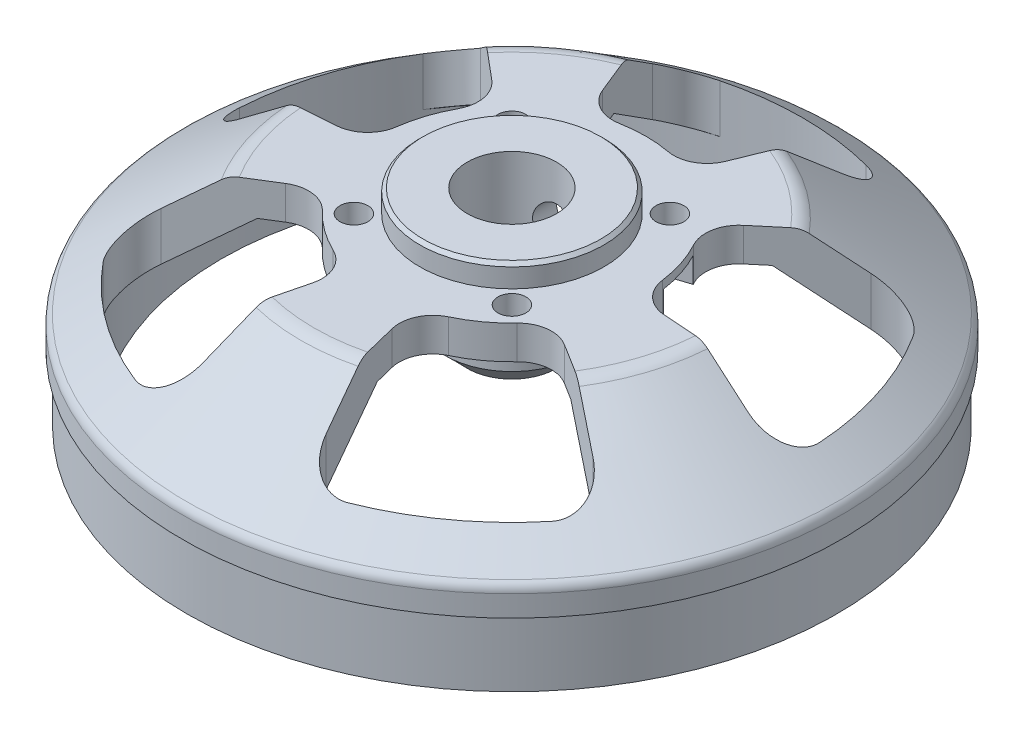
from build123d import *

# Parameters (mm, degrees)
SKETCH1_R           = 29.075
SKETCH1_R_2         = 26
BOSS_EXTRUDE1_DEPTH = 6
CUT_EXTRUDE1_DEPTH  = 45.863682
CIRPATTERN1_COUNT   = 5
SKETCH7_R           = 1.25
CUT_EXTRUDE2_DEPTH  = 45.863682
SKETCH8_R           = 6
BOSS_EXTRUDE3_DEPTH = 7
CHAMFER2_SIZE       = 2
SKETCH9_R           = 4
CUT_EXTRUDE3_DEPTH  = 44.410828
CUT_EXTRUDE4_START  = -2.25
CUT_EXTRUDE4_DEPTH  = 2.25
SKETCH11_R          = 1.75
CUT_EXTRUDE5_DEPTH  = 11
CIRPATTERN2_COUNT   = 2
CIRPATTERN2_ANGLE   = 72


with BuildPart() as part:
    # Sketch1 → Boss-Extrude1 (new body)
    with BuildSketch(Plane(origin=(0, 0, 0), x_dir=(1, 0, 0), z_dir=(0, 1, 0))):
        Circle(SKETCH1_R)
        Circle(SKETCH1_R_2, mode=Mode.SUBTRACT)
    extrude(amount=-BOSS_EXTRUDE1_DEPTH)

    # Sketch4 → Revolve3 (revolve)
    with BuildSketch(Plane(origin=(0, 0, 0), x_dir=(0, 0, -1), z_dir=(1, 0, 0))):
        with BuildLine():
            Line((-29.5, 1.890856), (-29.5, 0))
            Line((-29.5, 0), (-26, 0))
            Line((-26, 0), (-26, 0.617995))
            Line((-26, 0.617995), (-16.539783, 7.5))
            Line((-16.539783, 7.5), (-4, 7.5))
            Line((-4, 7.5), (-4, 10.5))
            Line((-4, 10.5), (-4, 12.5))
            Line((-4, 12.5), (-7.95, 12.5))
            Line((-7.95, 12.5), (-8.25, 12.2))
            Line((-8.25, 12.2), (-8.25, 10.5))
            Line((-8.25, 10.5), (-17.71498, 10.5))
            ThreePointArc((-17.71498, 10.5), (-18.33359, 10.401926), (-18.89153, 10.117322))
            Line((-18.89153, 10.117322), (-29.088275, 2.699517))
            ThreePointArc((-29.088275, 2.699517), (-29.391144, 2.344577), (-29.5, 1.890856))
        make_face()
    revolve(axis=Axis((0, 0, 0), (0, 1, 0)))

    # Sketch5 → Cut-Extrude1 (cut, through all)
    with BuildSketch(Plane(origin=(0, 10.5, 0), x_dir=(1, 0, 0), z_dir=(0, 1, 0))):
        with BuildLine():
            Line((-5.511352, 13.624427), (-8.551316, 21.139418))
            ThreePointArc((-8.551316, 21.139418), (-8.449813, 23.613453), (-6.522881, 25.168473))
            ThreePointArc((-6.522881, 25.168473), (0, 26), (6.522881, 25.168473))
            ThreePointArc((6.522881, 25.168473), (8.449813, 23.613453), (8.551316, 21.139418))
            Line((8.551316, 21.139418), (5.511352, 13.624427))
            ThreePointArc((5.511352, 13.624427), (4.172976, 12.119099), (2.184222, 11.799541))
            ThreePointArc((2.184222, 11.799541), (0, 12), (-2.184222, 11.799541))
            ThreePointArc((-2.184222, 11.799541), (-4.172976, 12.119099), (-5.511352, 13.624427))
        make_face()
    cut_extrude1 = extrude(amount=-CUT_EXTRUDE1_DEPTH, mode=Mode.SUBTRACT)

    # CirPattern1: Cut-Extrude1 ×5 about axis
    cirpattern1_axis = Axis((0, 0, 0), (0, 1, 0))
    for i in range(1, CIRPATTERN1_COUNT):
        add(cut_extrude1.rotate(cirpattern1_axis, i * 360 / CIRPATTERN1_COUNT), mode=Mode.SUBTRACT)

    # Sketch7 → Cut-Extrude2 (cut, through all)
    with BuildSketch(Plane(origin=(0, 10.5, 0), x_dir=(1, 0, 0), z_dir=(0, 1, 0))):
        with Locations((7.071068, 7.071068)):
            Circle(SKETCH7_R)
        with Locations((7.071068, -7.071068)):
            Circle(SKETCH7_R)
        with Locations((-7.071068, -7.071068)):
            Circle(SKETCH7_R)
        with Locations((-7.071068, 7.071068)):
            Circle(SKETCH7_R)
    extrude(amount=-CUT_EXTRUDE2_DEPTH, mode=Mode.SUBTRACT)

    # Sketch8 → Boss-Extrude3 (add)
    with BuildSketch(Plane(origin=(0, 7.5, 0), x_dir=(-1, 0, 0), z_dir=(0, -1, 0))):
        Circle(SKETCH8_R)
    extrude(amount=BOSS_EXTRUDE3_DEPTH)

    # Chamfer2
    chamfer2_edges = [part.edges().sort_by_distance(p)[0] for p in [
        (6, 0.5, 0),
    ]]
    chamfer(chamfer2_edges, length=CHAMFER2_SIZE)

    # Sketch9 → Cut-Extrude3 (cut, through all)
    with BuildSketch(Plane(origin=(0, 0.5, 0), x_dir=(-1, 0, 0), z_dir=(0, -1, 0))):
        Circle(SKETCH9_R)
    extrude(amount=-CUT_EXTRUDE3_DEPTH, mode=Mode.SUBTRACT)

    # Sketch10 → Cut-Extrude4 (cut)
    with BuildSketch(Plane.XZ.offset(-7.5).offset(CUT_EXTRUDE4_START)):
        with BuildLine():
            ThreePointArc((-2.075, -11.819237), (0, -12), (2.075, -11.819237))
            Line((2.075, -11.819237), (2.075, -8.075))
            ThreePointArc((2.075, -8.075), (0, -6), (-2.075, -8.075))
            Line((-2.075, -8.075), (-2.075, -11.819237))
        make_face()
    cut_extrude4 = extrude(amount=CUT_EXTRUDE4_DEPTH, mode=Mode.SUBTRACT)

    # Sketch11 → Cut-Extrude5 (cut)
    with BuildSketch(Plane(origin=(0, 0, -11.799541), x_dir=(-1, 0, 0), z_dir=(0, 0, -1))):
        with Locations((0, 7.5)):
            Circle(SKETCH11_R)
    cut_extrude5 = extrude(amount=-CUT_EXTRUDE5_DEPTH, mode=Mode.SUBTRACT)

    # CirPattern2: Cut-Extrude4, Cut-Extrude5 ×2 about axis
    cirpattern2_axis = Axis((0, 0, 0), (0, -1, 0))
    add([cut_extrude4.rotate(cirpattern2_axis, i * CIRPATTERN2_ANGLE / (CIRPATTERN2_COUNT - 1)) for i in range(1, CIRPATTERN2_COUNT)], mode=Mode.SUBTRACT)
    add([cut_extrude5.rotate(cirpattern2_axis, i * CIRPATTERN2_ANGLE / (CIRPATTERN2_COUNT - 1)) for i in range(1, CIRPATTERN2_COUNT)], mode=Mode.SUBTRACT)


solid = part.part
